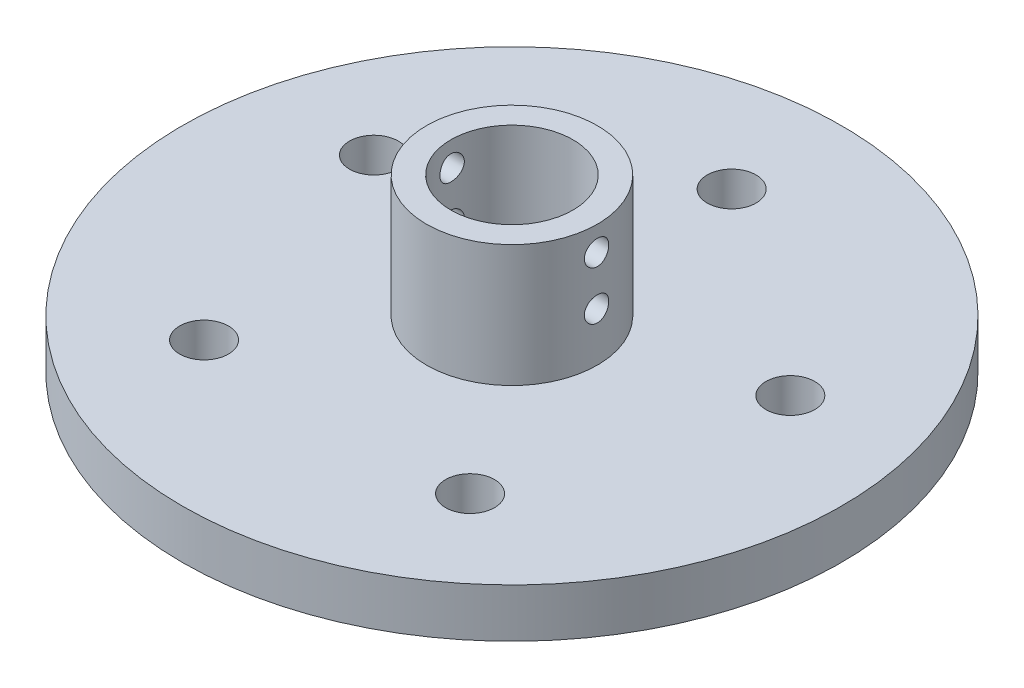
from build123d import *

# Parameters (mm, degrees)
F_1_2_20_TAPPED_HOLE1_D              = 12.7
SKETCH7_W                            = 3.175
SKETCH7_H                            = 85.725
F_1_4_0_25_DIAMETER_HOLE1_AT_2_COUNT = 2
F_1_4_0_25_DIAMETER_HOLE1_AT_2_PITCH = 12.7
F_1_4_0_25_DIAMETER_HOLE2_D          = 6.35


with BuildPart() as part:
    # Sketch1 → Revolve1 (revolve)
    with BuildSketch(Plane.XY):
        Polygon((15.875, 0), (85.725, 0), (85.725, 12.7), (22.225, 12.7), (22.225, 44.45), (15.875, 44.45), align=None)
    revolve(axis=Axis((0, 7.809475806, 0), (0, -1, 0)))

    # 1/2-20 Tapped Hole1 (through all)
    with Locations(Plane(origin=(0, 12.7, 0), x_dir=(1, 0, 0), z_dir=(0, 1, 0))):
        with Locations((-54.155626078, 18.25625), (0, 57.15), (54.155626078, 18.25625), (34.599427772, -45.486284722), (-34.599427772, -45.486284722)):
            Hole(F_1_2_20_TAPPED_HOLE1_D / 2)

    # Sketch7 → 1/4 (0.25) Diameter Hole1 (revolve, cut)
    with BuildSketch(Plane.ZX.offset(38.1)):
        with Locations((1.5875, 42.8625)):
            Rectangle(SKETCH7_W, SKETCH7_H)
    f_1_4_0_25_diameter_hole1 = revolve(axis=Axis((-6.35, 38.1, 0), (1, 0, 0)), mode=Mode.SUBTRACT)

    # 1/4 (0.25) Diameter Hole1 at 2: 1/4 (0.25) Diameter Hole1 ×2
    with Locations(*[(0, -i * F_1_4_0_25_DIAMETER_HOLE1_AT_2_PITCH, 0) for i in range(1, F_1_4_0_25_DIAMETER_HOLE1_AT_2_COUNT)]):
        add(f_1_4_0_25_diameter_hole1, mode=Mode.SUBTRACT)

    # 1/4 (0.25) Diameter Hole2 (through all)
    with Locations(Plane(origin=(0, 0, 0), x_dir=(0, 0, -1), z_dir=(1, 0, 0))):
        with Locations((0, 38.1), (0, 25.4)):
            Hole(F_1_4_0_25_DIAMETER_HOLE2_D / 2)


solid = part.part
